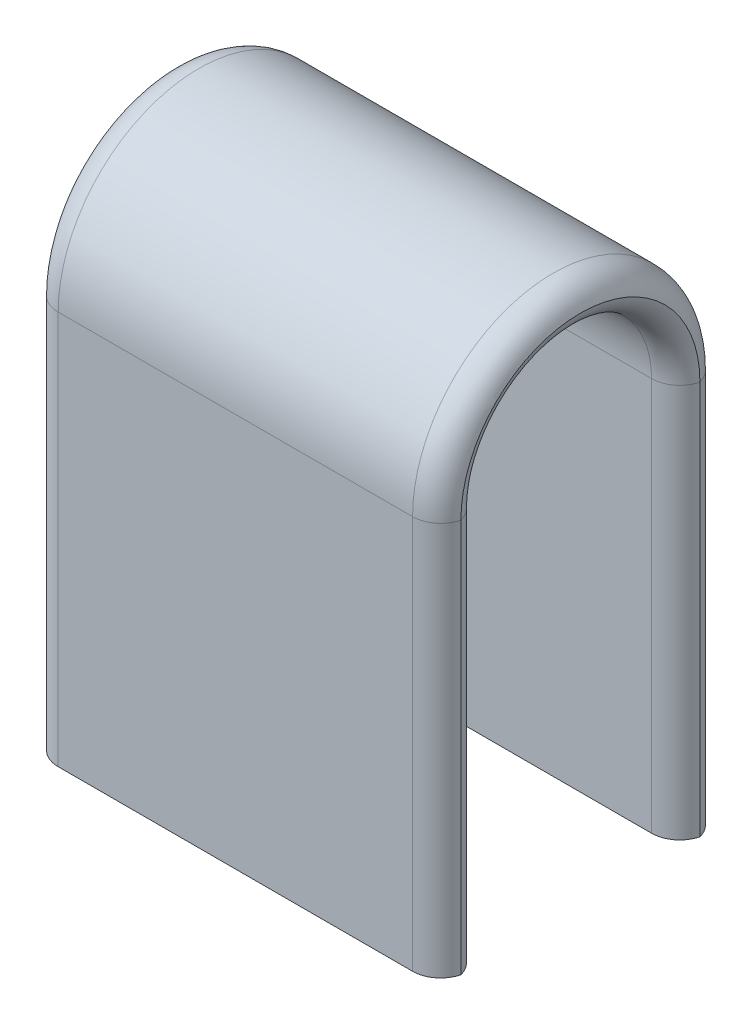
from build123d import *

# Parameters (mm, degrees)
SKETCH1_W           = 18.542
SKETCH1_H           = 17.78
BOSS_EXTRUDE4_DEPTH = 1.905
SKETCH4_W           = 18.542
SKETCH4_H           = 17.78
BOSS_EXTRUDE5_DEPTH = 1.905
BOSS_EXTRUDE6_DEPTH = 18.542
FILLET1_R           = 1.27


with BuildPart() as part:
    # Sketch1 → Boss-Extrude4 (new body)
    with BuildSketch(Plane.XY):
        Rectangle(SKETCH1_W, SKETCH1_H)
    extrude(amount=-BOSS_EXTRUDE4_DEPTH)



with BuildPart() as body_2:
    # Sketch4 → Boss-Extrude5 (new body)
    with BuildSketch(Plane.XY.offset(-12.7)):
        Rectangle(SKETCH4_W, SKETCH4_H)
    extrude(amount=BOSS_EXTRUDE5_DEPTH)


with BuildPart() as part_1:
    add(part.part)

    add(body_2.part)  # Boss-Extrude6 merges body 2
    # Sketch6 → Boss-Extrude6 (add)
    with BuildSketch(Plane.ZY.offset(9.271)):
        with BuildLine():
            Line((-12.7, 8.89), (-10.795, 8.89))
            ThreePointArc((-10.795, 8.89), (-6.35, 13.335), (-1.905, 8.89))
            Line((-1.905, 8.89), (0, 8.89))
            ThreePointArc((0, 8.89), (-6.35, 15.24), (-12.7, 8.89))
        make_face()
    extrude(amount=-BOSS_EXTRUDE6_DEPTH)

    # Fillet1
    # the kernel refuses this fillet: 1.27 mm, written as the material it takes off along each edge
    with BuildSketch(Plane(origin=(9.271, 8.89, -6.35), x_dir=(0, 0, -1), z_dir=(0, -1, 0))) as fillet1_piece_1:
        with BuildLine():
            CenterArc((4.445 + FILLET1_R, -FILLET1_R), FILLET1_R, 90, 90)
            Line((4.445, -FILLET1_R), (4.445, 0))
            Line((4.445, 0), (4.445 + FILLET1_R, 0))
        make_face()
    revolve(axis=Axis((9.271, 8.89, -6.35), (1, 0, 0)), revolution_arc=180, mode=Mode.SUBTRACT)
    with BuildSketch(Plane(origin=(-9.271, 8.89, -6.35), x_dir=(0, 0, -1), z_dir=(0, -1, 0))) as fillet1_piece_2:
        with BuildLine():
            CenterArc((4.445 + FILLET1_R, FILLET1_R), FILLET1_R, 180, 90)
            Line((4.445, FILLET1_R), (4.445, 0))
            Line((4.445, 0), (4.445 + FILLET1_R, 0))
        make_face()
    revolve(axis=Axis((-9.271, 8.89, -6.35), (1, 0, 0)), revolution_arc=180, mode=Mode.SUBTRACT)
    with BuildSketch(Plane(origin=(9.271, 8.89, -6.35), x_dir=(0, 0, 1), z_dir=(0, -1, 0))) as fillet1_piece_3:
        with BuildLine():
            CenterArc((6.35 - FILLET1_R, FILLET1_R), FILLET1_R, 270, 90)
            Line((6.35, FILLET1_R), (6.35, 0))
            Line((6.35, 0), (6.35 - FILLET1_R, 0))
        make_face()
    revolve(axis=Axis((9.271, 8.89, -6.35), (-1, 0, 0)), revolution_arc=180, mode=Mode.SUBTRACT)
    with BuildSketch(Plane(origin=(-9.271, 8.89, -6.35), x_dir=(0, 0, 1), z_dir=(0, -1, 0))) as fillet1_piece_4:
        with BuildLine():
            CenterArc((6.35 - FILLET1_R, -FILLET1_R), FILLET1_R, 0, 90)
            Line((6.35, -FILLET1_R), (6.35, 0))
            Line((6.35, 0), (6.35 - FILLET1_R, 0))
        make_face()
    revolve(axis=Axis((-9.271, 8.89, -6.35), (-1, 0, 0)), revolution_arc=180, mode=Mode.SUBTRACT)
    with BuildSketch(Plane(origin=(-9.271, -12.065, -12.7), x_dir=(0, 0, 1), z_dir=(0, 1, 0)), Plane(origin=(-9.271, 8.89, 0), x_dir=(0, 0, -1), z_dir=(0, -1, 0)), Plane(origin=(9.271, -12.065, 0), x_dir=(0, 0, -1), z_dir=(0, 1, 0)), Plane(origin=(9.271, 8.89, -12.7), x_dir=(0, 0, 1), z_dir=(0, -1, 0))) as fillet1_piece_5:
        with BuildLine():
            CenterArc((FILLET1_R, FILLET1_R), FILLET1_R, 180, 90)
            Line((0, FILLET1_R), (0, 0))
            Line((0, 0), (FILLET1_R, 0))
        make_face()
    extrude(amount=20.955, mode=Mode.SUBTRACT)
    with BuildSketch(Plane(origin=(-9.271, -12.065, -10.795), x_dir=(0, 0, -1), z_dir=(0, 1, 0)), Plane(origin=(-9.271, 8.89, -1.905), x_dir=(0, 0, 1), z_dir=(0, -1, 0)), Plane(origin=(9.271, -12.065, -1.905), x_dir=(0, 0, 1), z_dir=(0, 1, 0)), Plane(origin=(9.271, 8.89, -10.795), x_dir=(0, 0, -1), z_dir=(0, -1, 0))) as fillet1_piece_6:
        with BuildLine():
            CenterArc((FILLET1_R, -FILLET1_R), FILLET1_R, 90, 90)
            Line((0, -FILLET1_R), (0, 0))
            Line((0, 0), (FILLET1_R, 0))
        make_face()
    extrude(amount=20.955, mode=Mode.SUBTRACT)


solid = part_1.part
